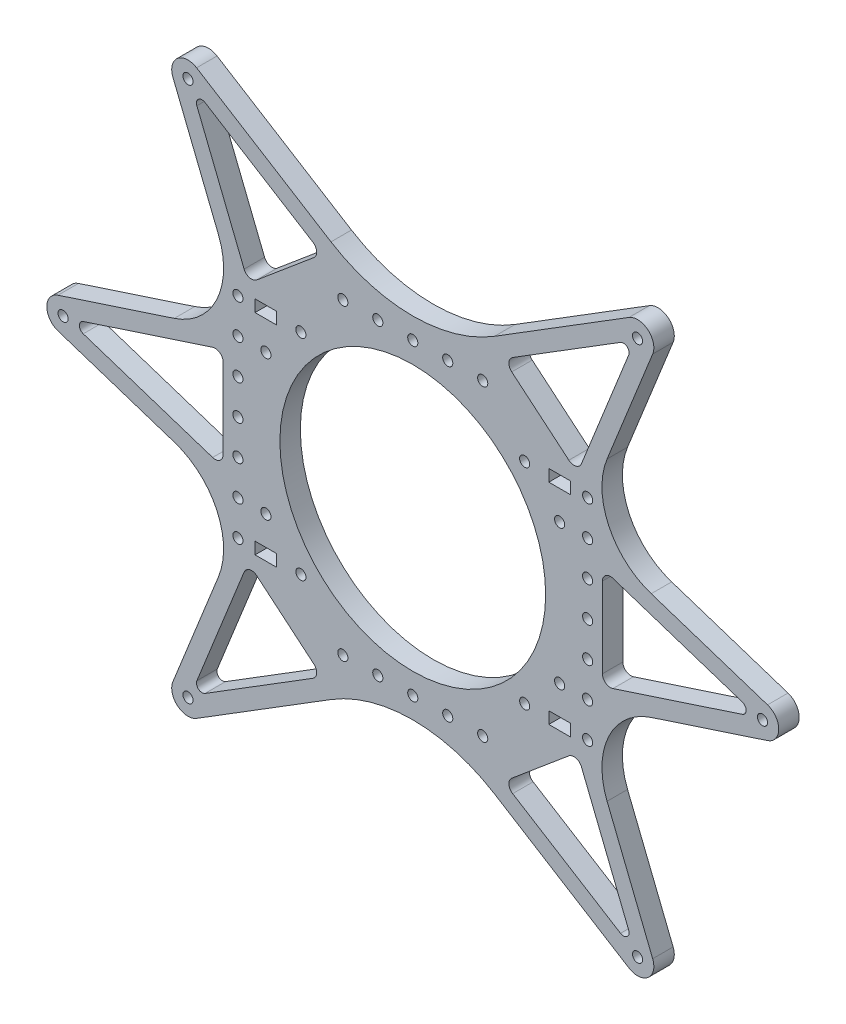
from build123d import *

# Parameters (mm, degrees)
SKETCH1_R           = 1.450000006
SKETCH1_R_2         = 1.45
SKETCH1_R_3         = 38
SKETCH1_W           = 6.2
SKETCH1_H           = 3.4
BOSS_EXTRUDE1_DEPTH = 5.85


with BuildPart() as part:
    # Sketch1 → Boss-Extrude1 (new body)
    with BuildSketch(Plane.XY):
        with BuildLine():
            Line((587.995290395, 497.753361998), (601.026388312, 465.269666287))
            ThreePointArc((601.026388312, 465.269666287), (600.580353033, 449.003385667), (588.406365105, 438.205939183))
            Line((588.406365105, 438.205939183), (555.146182231, 427.30822221))
            ThreePointArc((555.146182231, 427.30822221), (551.939243509, 422.882775531), (555.146182231, 418.457328853))
            Line((555.146182231, 418.457328853), (588.406366938, 407.55961128))
            ThreePointArc((588.406366938, 407.55961128), (600.58035448, 396.762164902), (601.026389221, 380.495884628))
            Line((601.026389221, 380.495884628), (587.995289899, 348.01218948))
            ThreePointArc((587.995289899, 348.01218948), (589.32399836, 342.710908714), (594.775468563, 342.322944064))
            Line((594.775468563, 342.322944064), (633.210915705, 366.208380082))
            ThreePointArc((633.210915705, 366.208380082), (644.436635852, 371.181514399), (656.596182238, 372.882775531))
            ThreePointArc((656.596182238, 372.882775531), (668.755728624, 371.181514399), (679.981448771, 366.208380082))
            Line((679.981448771, 366.208380082), (718.416895913, 342.322944064))
            ThreePointArc((718.416895913, 342.322944064), (723.868366115, 342.710908714), (725.197074576, 348.01218948))
            Line((725.197074576, 348.01218948), (712.165975255, 380.495884628))
            ThreePointArc((712.165975255, 380.495884628), (712.612009996, 396.762164902), (724.785997538, 407.559611279))
            Line((724.785997538, 407.559611279), (758.046182244, 418.457328853))
            ThreePointArc((758.046182244, 418.457328853), (761.253120966, 422.882775531), (758.046182244, 427.30822221))
            Line((758.046182244, 427.30822221), (724.785999371, 438.205939183))
            ThreePointArc((724.785999371, 438.205939183), (712.612011443, 449.003385667), (712.165976164, 465.269666287))
            Line((712.165976164, 465.269666287), (725.197074081, 497.753361998))
            ThreePointArc((725.197074081, 497.753361998), (723.86836572, 503.054641878), (718.416896408, 503.442606583))
            Line((718.416896408, 503.442606583), (679.981448771, 479.557172561))
            ThreePointArc((679.981448771, 479.557172561), (668.755728555, 474.584038083), (656.596182238, 472.882775531))
            ThreePointArc((656.596182238, 472.882775531), (644.436635921, 474.584038083), (633.210915705, 479.557172561))
            Line((633.210915705, 479.557172561), (594.775468067, 503.442606583))
            ThreePointArc((594.775468067, 503.442606583), (589.323998755, 503.054641878), (587.995290395, 497.753361998))
        make_face()
        with Locations((592.317421269, 499.487219843)):
            Circle(SKETCH1_R, mode=Mode.SUBTRACT)
        with Locations((706.596182238, 432.882775531)):
            Circle(SKETCH1_R_2, mode=Mode.SUBTRACT)
        with Locations((706.596182238, 442.882775531)):
            Circle(SKETCH1_R_2, mode=Mode.SUBTRACT)
        with Locations((706.596182238, 452.882775531)):
            Circle(SKETCH1_R_2, mode=Mode.SUBTRACT)
        with Locations((706.596182238, 392.882775531)):
            Circle(SKETCH1_R_2, mode=Mode.SUBTRACT)
        with Locations((556.596182238, 422.882775531)):
            Circle(SKETCH1_R, mode=Mode.SUBTRACT)
        with Locations((646.596182238, 378.882775531)):
            Circle(SKETCH1_R_2, mode=Mode.SUBTRACT)
        with Locations((656.596182238, 422.882775531)):
            Circle(SKETCH1_R_3, mode=Mode.SUBTRACT)
        with Locations((636.596182238, 378.882775531)):
            Circle(SKETCH1_R_2, mode=Mode.SUBTRACT)
        with Locations((706.596182238, 402.882775531)):
            Circle(SKETCH1_R_2, mode=Mode.SUBTRACT)
        with Locations((656.596182238, 466.882775531)):
            Circle(SKETCH1_R_2, mode=Mode.SUBTRACT)
        with Locations((592.317421269, 346.278331219)):
            Circle(SKETCH1_R, mode=Mode.SUBTRACT)
        with Locations((706.596182238, 412.882775531)):
            Circle(SKETCH1_R_2, mode=Mode.SUBTRACT)
        with Locations((656.596182238, 378.882775531)):
            Circle(SKETCH1_R_2, mode=Mode.SUBTRACT)
        with Locations((698.596182238, 442.882775531)):
            Circle(SKETCH1_R_2, mode=Mode.SUBTRACT)
        with Locations((698.596182238, 402.882775531)):
            Circle(SKETCH1_R_2, mode=Mode.SUBTRACT)
        with Locations((646.596182238, 466.882775531)):
            Circle(SKETCH1_R_2, mode=Mode.SUBTRACT)
        with Locations((636.596182238, 466.882775531)):
            Circle(SKETCH1_R_2, mode=Mode.SUBTRACT)
        with Locations((676.596182238, 466.882775531)):
            Circle(SKETCH1_R_2, mode=Mode.SUBTRACT)
        with Locations((666.596182238, 466.882775531)):
            Circle(SKETCH1_R_2, mode=Mode.SUBTRACT)
        with Locations((706.596182238, 422.882775531)):
            Circle(SKETCH1_R_2, mode=Mode.SUBTRACT)
        with Locations((688.596182238, 452.882775531)):
            Circle(SKETCH1_R_2, mode=Mode.SUBTRACT)
        with Locations((688.596182238, 392.882775531)):
            Circle(SKETCH1_R_2, mode=Mode.SUBTRACT)
        with Locations((624.596182238, 392.882775531)):
            Circle(SKETCH1_R_2, mode=Mode.SUBTRACT)
        with Locations((720.874943207, 346.278331219)):
            Circle(SKETCH1_R, mode=Mode.SUBTRACT)
        with Locations((676.596182238, 378.882775531)):
            Circle(SKETCH1_R_2, mode=Mode.SUBTRACT)
        with Locations((666.596182238, 378.882775531)):
            Circle(SKETCH1_R_2, mode=Mode.SUBTRACT)
        with Locations((756.596182238, 422.882775531)):
            Circle(SKETCH1_R, mode=Mode.SUBTRACT)
        with Locations((624.596182238, 452.882775531)):
            Circle(SKETCH1_R_2, mode=Mode.SUBTRACT)
        with Locations((606.596182238, 422.882775531)):
            Circle(SKETCH1_R_2, mode=Mode.SUBTRACT)
        with Locations((720.874943207, 499.487219843)):
            Circle(SKETCH1_R, mode=Mode.SUBTRACT)
        with Locations((614.596182238, 402.882775531)):
            Circle(SKETCH1_R_2, mode=Mode.SUBTRACT)
        with Locations((614.596182238, 442.882775531)):
            Circle(SKETCH1_R_2, mode=Mode.SUBTRACT)
        with Locations((606.596182238, 412.882775531)):
            Circle(SKETCH1_R_2, mode=Mode.SUBTRACT)
        with Locations((606.596182238, 402.882775531)):
            Circle(SKETCH1_R_2, mode=Mode.SUBTRACT)
        with Locations((606.596182238, 392.882775531)):
            Circle(SKETCH1_R_2, mode=Mode.SUBTRACT)
        with Locations((606.596182238, 452.882775531)):
            Circle(SKETCH1_R_2, mode=Mode.SUBTRACT)
        with Locations((606.596182238, 442.882775531)):
            Circle(SKETCH1_R_2, mode=Mode.SUBTRACT)
        with Locations((606.596182238, 432.882775531)):
            Circle(SKETCH1_R_2, mode=Mode.SUBTRACT)
        with BuildLine():
            Line((594.852213644, 494.089955534), (608.369257372, 460.394902501))
            ThreePointArc((608.369257372, 460.394902501), (609.936297881, 459.027594122), (611.962982661, 459.494174197))
            Line((611.962982661, 459.494174197), (628.291466753, 473.195399177))
            ThreePointArc((628.291466753, 473.195399177), (629.102888547, 475.11027328), (628.028466383, 476.890937531))
            Line((628.028466383, 476.890937531), (597.192526929, 496.053711548))
            ThreePointArc((597.192526929, 496.053711548), (595.310843783, 495.919797808), (594.852213644, 494.089955534))
        make_face(mode=Mode.SUBTRACT)
        with Locations((698.596182238, 392.882775531)):
            Rectangle(SKETCH1_W, SKETCH1_H, mode=Mode.SUBTRACT)
        with BuildLine():
            Line((562.360059701, 421.35524452), (599.360059701, 409.232174436))
            ThreePointArc((599.360059701, 409.232174436), (601.41475291, 409.553708225), (602.360059701, 411.406150729))
            Line((602.360059701, 411.406150729), (602.360059701, 434.359400333))
            ThreePointArc((602.360059701, 434.359400333), (601.41475291, 436.211842837), (599.360059701, 436.533376627))
            Line((599.360059701, 436.533376627), (562.360059701, 424.410306542))
            ThreePointArc((562.360059701, 424.410306542), (561.253120966, 422.882775531), (562.360059701, 421.35524452))
        make_face(mode=Mode.SUBTRACT)
        with BuildLine():
            Line((594.85221424, 351.675595364), (608.369259134, 385.370647084))
            ThreePointArc((608.369259134, 385.370647084), (609.936299703, 386.737955426), (611.962984497, 386.271375324))
            Line((611.962984497, 386.271375324), (628.291464916, 372.570153427))
            ThreePointArc((628.291464916, 372.570153427), (629.102886739, 370.655279313), (628.028464622, 368.874615009))
            Line((628.028464622, 368.874615009), (597.192526664, 349.711840073))
            ThreePointArc((597.192526664, 349.711840073), (595.310844178, 349.845753725), (594.85221424, 351.675595364))
        make_face(mode=Mode.SUBTRACT)
        with Locations((614.596182238, 452.882775531)):
            Rectangle(SKETCH1_W, SKETCH1_H, mode=Mode.SUBTRACT)
        with Locations((698.596182238, 452.882775531)):
            Rectangle(SKETCH1_W, SKETCH1_H, mode=Mode.SUBTRACT)
        with BuildLine():
            Line((715.999837812, 349.711840073), (685.163899854, 368.874615009))
            ThreePointArc((685.163899854, 368.874615009), (684.089477737, 370.655279313), (684.900899559, 372.570153427))
            Line((684.900899559, 372.570153427), (701.229379978, 386.271375324))
            ThreePointArc((701.229379978, 386.271375324), (703.256064773, 386.737955426), (704.823105342, 385.370647084))
            Line((704.823105342, 385.370647084), (718.340150235, 351.675595364))
            ThreePointArc((718.340150235, 351.675595364), (717.881520298, 349.845753725), (715.999837812, 349.711840073))
        make_face(mode=Mode.SUBTRACT)
        with BuildLine():
            Line((750.832304774, 424.410306542), (713.832304774, 436.533376627))
            ThreePointArc((713.832304774, 436.533376627), (711.777611566, 436.211842837), (710.832304774, 434.359400333))
            Line((710.832304774, 434.359400333), (710.832304774, 411.406150729))
            ThreePointArc((710.832304774, 411.406150729), (711.777611565, 409.553708225), (713.832304774, 409.232174436))
            Line((713.832304774, 409.232174436), (750.832304774, 421.35524452))
            ThreePointArc((750.832304774, 421.35524452), (751.939243509, 422.882775531), (750.832304774, 424.410306542))
        make_face(mode=Mode.SUBTRACT)
        with BuildLine():
            Line((684.900897722, 473.195399177), (701.229381815, 459.494174197))
            ThreePointArc((701.229381815, 459.494174197), (703.256066594, 459.027594122), (704.823107103, 460.394902501))
            Line((704.823107103, 460.394902501), (718.340150832, 494.089955534))
            ThreePointArc((718.340150832, 494.089955534), (717.881520693, 495.919797808), (715.999837547, 496.053711548))
            Line((715.999837547, 496.053711548), (685.163898093, 476.890937531))
            ThreePointArc((685.163898093, 476.890937531), (684.089475929, 475.11027328), (684.900897722, 473.195399177))
        make_face(mode=Mode.SUBTRACT)
        with Locations((614.596182238, 392.882775531)):
            Rectangle(SKETCH1_W, SKETCH1_H, mode=Mode.SUBTRACT)
    extrude(amount=BOSS_EXTRUDE1_DEPTH)


solid = part.part
